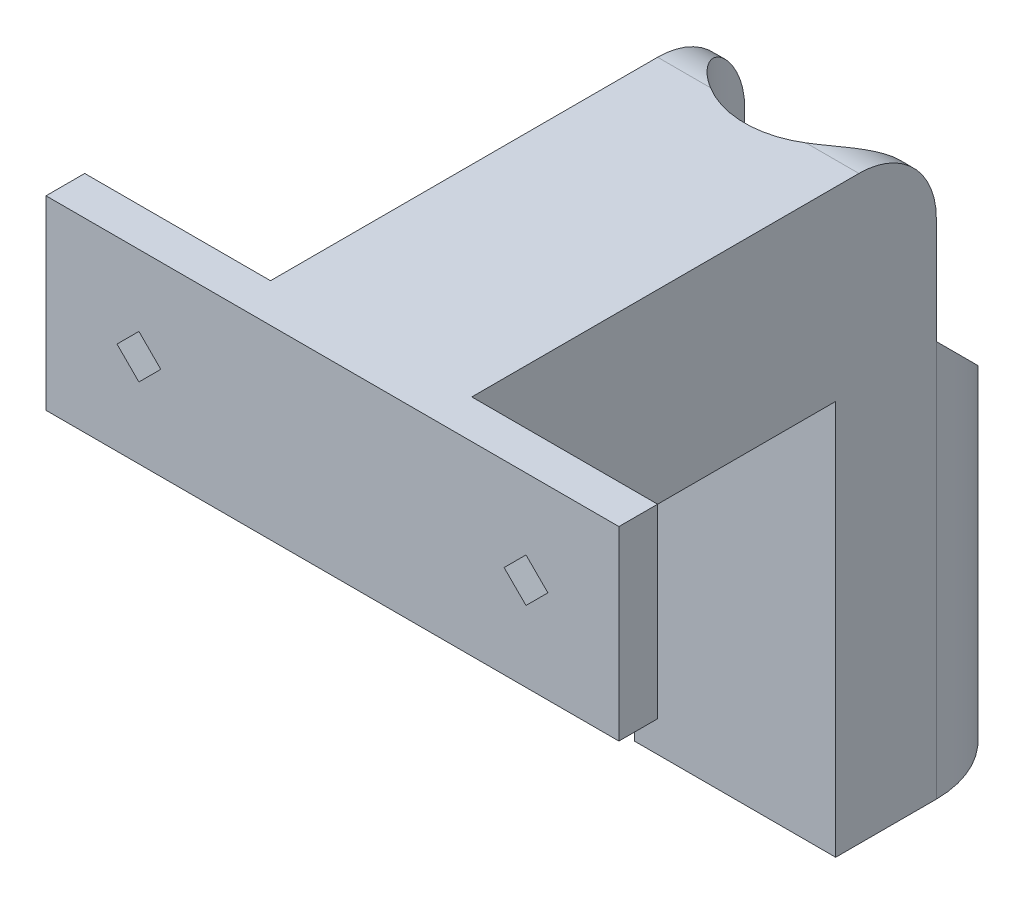
from build123d import *

# Parameters (mm, degrees)
SKETCH1_R           = 13
SKETCH1_R_2         = 11.25
BOSS_EXTRUDE1_DEPTH = 1.2
SKETCH2_R           = 13
SKETCH2_R_2         = 11.75
BOSS_EXTRUDE2_DEPTH = 50
CHAMFER1_SIZE       = 0.5
BOSS_EXTRUDE3_DEPTH = 75
SKETCH4_W           = 52
SKETCH4_H           = 24
BOSS_EXTRUDE4_DEPTH = 26
SKETCH5_W           = 24
SKETCH5_H           = 24
BOSS_EXTRUDE5_DEPTH = 5
CUT_EXTRUDE1_DEPTH  = 112.130553854
FILLET1_R           = 10


with BuildPart() as part:
    # Sketch1 → Boss-Extrude1 (new body)
    with BuildSketch(Plane(origin=(0, 0, 0), x_dir=(1, 0, 0), z_dir=(0, 1, 0))):
        with Locations(Location((0, 0, 0), (0, 0, 270))):
            Circle(SKETCH1_R)
        with Locations(Location((0, 0, 0), (0, 0, 270))):
            Circle(SKETCH1_R_2, mode=Mode.SUBTRACT)
    extrude(amount=BOSS_EXTRUDE1_DEPTH)

    # Sketch2 → Boss-Extrude2 (add)
    with BuildSketch(Plane(origin=(0, 1.2, 0), x_dir=(1, 0, 0), z_dir=(0, 1, 0))):
        with Locations(Location((0, 0, 0), (0, 0, 270))):
            Circle(SKETCH2_R)
        with Locations(Location((0, 0, 0), (0, 0, 270))):
            Circle(SKETCH2_R_2, mode=Mode.SUBTRACT)
    extrude(amount=BOSS_EXTRUDE2_DEPTH)

    # Chamfer1
    chamfer1_edges = [part.edges().sort_by_distance(p)[0] for p in [
        (0, 1.2, -11.25),
    ]]
    chamfer(chamfer1_edges, length=CHAMFER1_SIZE - 0.0001)  # a hair under: the kernel refuses the full size

    # Sketch3 → Boss-Extrude3 (add)
    with BuildSketch(Plane.XZ):
        with BuildLine():
            Line((-13, 0), (-13, 13))
            Line((-13, 13), (0, 13))
            Line((0, 13), (13, 13))
            Line((13, 13), (13, 0))
            Line((13, 0), (11.75, 0))
            ThreePointArc((11.75, 0), (0, 11.75), (-11.75, 0))
            Line((-11.75, 0), (-13, 0))
        make_face()
    extrude(amount=-BOSS_EXTRUDE3_DEPTH)

    # Sketch4 → Boss-Extrude4 (add)
    with BuildSketch(Plane(origin=(13, 0, 0), x_dir=(0, 0, -1), z_dir=(1, 0, 0))):
        with Locations((-39, 63)):
            Rectangle(SKETCH4_W, SKETCH4_H)
    extrude(amount=-BOSS_EXTRUDE4_DEPTH)

    # Sketch5 → Boss-Extrude5 (add)
    # profile 1 of 2: a face of its own
    with BuildSketch(Plane.XY.offset(65)):
        with Locations((-25, 63)):
            Rectangle(SKETCH5_W, SKETCH5_H)
        Polygon((-27.828427125, 63), (-25, 65.828427125), (-22.171572875, 63), (-25, 60.171572875), align=None, mode=Mode.SUBTRACT)
    # profile 2 of 2: a face of its own
    with BuildSketch(Plane.XY.offset(65)):
        with Locations((25, 63)):
            Rectangle(SKETCH5_W, SKETCH5_H)
        Polygon((22.171572875, 63), (25, 65.828427125), (27.828427125, 63), (25, 60.171572875), align=None, mode=Mode.SUBTRACT)
    extrude(amount=-BOSS_EXTRUDE5_DEPTH)

    # Sketch6 → Cut-Extrude1 (cut, through all)
    with BuildSketch(Plane.ZY.offset(13)):
        Polygon((0, 51.2), (-13, 38.2), (-13, 51.2), align=None)
    extrude(amount=-CUT_EXTRUDE1_DEPTH, mode=Mode.SUBTRACT)

    # Fillet1
    fillet1_edges = [part.edges().sort_by_distance(p)[0] for p in [
        (-12.375, 75, 0),
        (12.375, 75, 0),
    ]]
    fillet(fillet1_edges, radius=FILLET1_R)


solid = part.part
